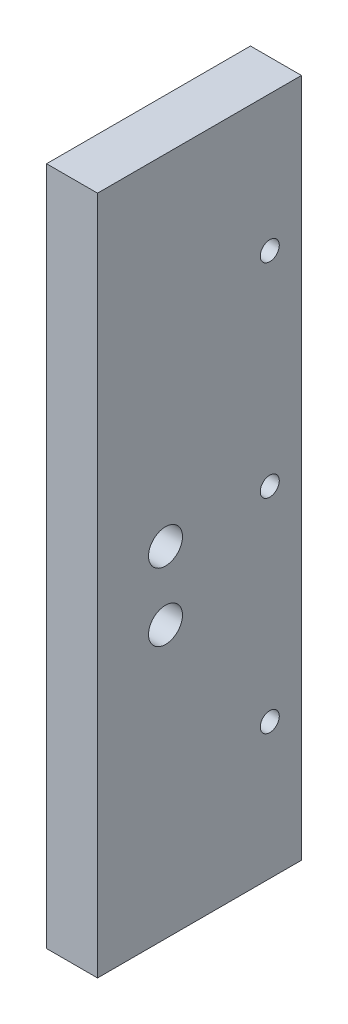
from build123d import *

# Parameters (mm, degrees)
SKETCH1_W           = 9.525
SKETCH1_H           = 127
BOSS_EXTRUDE1_DEPTH = 38.1
SKETCH2_R           = 1.778
CUT_EXTRUDE1_DEPTH  = 133.933575988
SKETCH3_R           = 3.175
CUT_EXTRUDE2_DEPTH  = 38.1


with BuildPart() as part:
    # Sketch1 → Boss-Extrude1 (new body)
    with BuildSketch(Plane.XY):
        with Locations((4.7625, 63.5)):
            Rectangle(SKETCH1_W, SKETCH1_H)
    extrude(amount=BOSS_EXTRUDE1_DEPTH)

    # Sketch2 → Cut-Extrude1 (cut, through all)
    with BuildSketch(Plane.ZY):
        with Locations((5.9182, 101.6)):
            Circle(SKETCH2_R)
        with Locations((5.9182, 63.5)):
            Circle(SKETCH2_R)
        with Locations((5.9182, 25.4)):
            Circle(SKETCH2_R)
    extrude(amount=-CUT_EXTRUDE1_DEPTH, mode=Mode.SUBTRACT)

    # Sketch3 → Cut-Extrude2 (cut)
    with BuildSketch(Plane(origin=(9.525, 0, 0), x_dir=(0, 0, -1), z_dir=(1, 0, 0))):
        with Locations((-25.4, 63.5)):
            Circle(SKETCH3_R)
        with Locations((-25.4, 50.8)):
            Circle(SKETCH3_R)
    extrude(amount=-CUT_EXTRUDE2_DEPTH, mode=Mode.SUBTRACT)


solid = part.part
